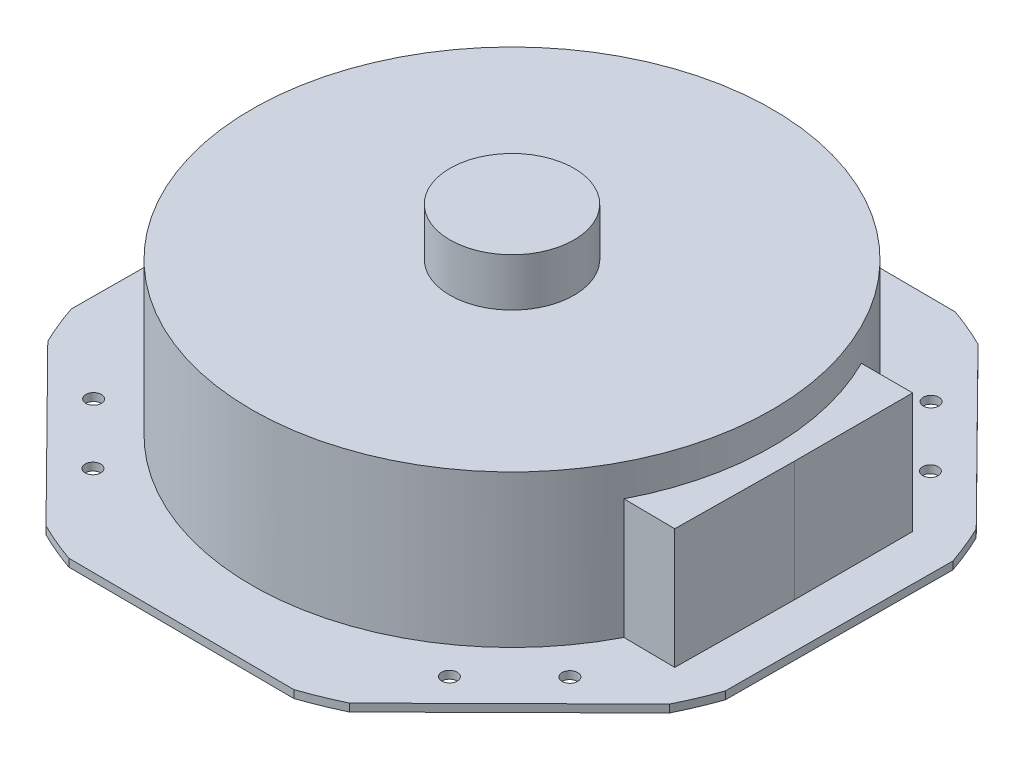
from build123d import *

# Parameters (mm, degrees)
EXTRUDE_1_DEPTH          = 10
SKETCH_3_R               = 335.5
EXTRUDE_4_DEPTH          = 196
EXTRUDE_5_DEPTH          = 154.8
SHELL_START              = 10
SHELL_3_OUTLINE_R        = 330.5
SHELL_3_DEPTH            = 191
SHELL_3_2_DEPTH          = 149.8
CUT_EXTRUDE_1_DEPTH      = 154.8
SKETCH_8_R               = 80
EXTRUDE_7_DEPTH          = 61.8
SKETCH_9_R               = 80
EXTRUDE_8_DEPTH          = 123.6
SKETCH_10_R              = 75
CUT_EXTRUDE_2_DEPTH      = 185.4
SKETCH_11_R              = 10
CUT_EXTRUDE_4_DEPTH      = 1000
PATTERN_CIRCULAR_1_COUNT = 4


# Read off the part's stored shape, not the designer's step: 抽壳3
with BuildPart() as part:
    # 草图2 → 凸台-拉伸1 (new body)
    with BuildSketch(Plane(origin=(0, 0, 0), x_dir=(1, 0, 0), z_dir=(0, 1, 0))):
        with BuildLine():
            ThreePointArc((198.880672379, 401.826082595), (173.884394221, 413.257716136), (148.234596604, 423.136180053))
            Line((148.234596604, 423.136180053), (-143.504075774, 424.763819947))
            ThreePointArc((-143.504075774, 424.763819947), (-169.262499161, 415.172167754), (-194.384773816, 404.020150746))
            Line((-194.384773816, 404.020150746), (-401.826082595, 198.880672379))
            ThreePointArc((-401.826082595, 198.880672379), (-413.257716136, 173.884394221), (-423.136180053, 148.234596604))
            Line((-423.136180053, 148.234596604), (-424.763819947, -143.504075774))
            ThreePointArc((-424.763819947, -143.504075774), (-415.172167754, -169.262499161), (-404.020150746, -194.384773816))
            Line((-404.020150746, -194.384773816), (-198.880672379, -401.826082595))
            ThreePointArc((-198.880672379, -401.826082595), (-173.884394221, -413.257716136), (-148.234596604, -423.136180053))
            Line((-148.234596604, -423.136180053), (143.504075774, -424.763819947))
            ThreePointArc((143.504075774, -424.763819947), (169.262499161, -415.172167754), (194.384773816, -404.020150746))
            Line((194.384773816, -404.020150746), (401.826082595, -198.880672379))
            ThreePointArc((401.826082595, -198.880672379), (413.257716136, -173.884394221), (423.136180053, -148.234596604))
            Line((423.136180053, -148.234596604), (424.763819947, 143.504075774))
            ThreePointArc((424.763819947, 143.504075774), (415.172167754, 169.262499161), (404.020150746, 194.384773816))
            Line((404.020150746, 194.384773816), (198.880672379, 401.826082595))
        make_face()
    extrude(amount=EXTRUDE_1_DEPTH)

    # 草图7 → 切除-拉伸1 (cut)
    with BuildSketch(Plane.XZ.offset(-10)):
        with BuildLine():
            Line((354.410601365, 144.423875342), (292.048813878, 143.7280081))
            ThreePointArc((292.048813878, 143.7280081), (-325.4949343, -1.815969532), (293.634330198, -140.460421931))
            Line((293.634330198, -140.460421931), (356, -140.460421931))
            Line((356, -140.460421931), (356, 1.986160414))
            Line((356, 1.986160414), (354.410601365, 144.423875342))
        make_face()
    extrude(amount=CUT_EXTRUDE_1_DEPTH, mode=Mode.SUBTRACT)


with BuildPart() as body_2:
    # 草图3 → 凸台-拉伸4 (new body)
    with BuildSketch(Plane(origin=(0, 10, 0), x_dir=(1, 0, 0), z_dir=(0, 1, 0))):
        with Locations(Location((0, 0, 0), (0, 0, 270))):
            Circle(SKETCH_3_R)
    extrude(amount=EXTRUDE_4_DEPTH)


with BuildPart() as body_3:
    # 草图6 → 凸台-拉伸5 (new body)
    with BuildSketch(Plane(origin=(0, 10, 0), x_dir=(1, 0, 0), z_dir=(0, 1, 0))):
        with BuildLine():
            Line((366, -2.041951437), (335.494778671, -1.871759687))
            ThreePointArc((335.494778671, -1.871759687), (325.812555489, -80.040169201), (298.172341087, -153.796960343))
            Line((298.172341087, -153.796960343), (364.298400285, -154.534831406))
            Line((364.298400285, -154.534831406), (366, -2.041951437))
        make_face()
        with BuildLine():
            ThreePointArc((335.5, 0), (335.498694665, -0.935883485), (335.494778671, -1.871759687))
            Line((335.494778671, -1.871759687), (366, -2.041951437))
            Line((366, -2.041951437), (366, 150.460421931))
            Line((366, 150.460421931), (299.869824144, 150.460421931))
            ThreePointArc((299.869824144, 150.460421931), (326.470960424, 77.310814249), (335.5, 0))
        make_face()
    extrude(amount=EXTRUDE_5_DEPTH)


with BuildPart() as body_2_1:
    add(body_2.part)

    # Combine 1: union body 3
    add(body_3.part)

    # 抽壳3 outline → 抽壳3 (cut)
    with BuildSketch(Plane(origin=(0, 0, 0), x_dir=(1, 0, 0), z_dir=(0, 1, 0)).offset(SHELL_START)):
        Circle(SHELL_3_OUTLINE_R)
    extrude(amount=SHELL_3_DEPTH, mode=Mode.SUBTRACT)

    # Shell 3 2 outline → Shell 3 2 (cut)
    with BuildSketch(Plane(origin=(0, 0, 0), x_dir=(1, 0, 0), z_dir=(0, 1, 0)).offset(SHELL_START)):
        with BuildLine():
            ThreePointArc((296.76845461, 145.460421931), (330.494856485, -1.84386461), (295.126953902, -148.762666958))
            Line((295.126953902, -148.762666958), (359.354500825, -149.479353374))
            Line((359.354500825, -149.479353374), (361, -2.014055926))
            Line((361, -2.014055926), (361, 145.460421931))
            Line((361, 145.460421931), (296.76845461, 145.460421931))
        make_face()
    extrude(amount=SHELL_3_2_DEPTH, mode=Mode.SUBTRACT)

    # Combine 2: union part
    add(part.part)

    # 草图8 → 凸台-拉伸7 (add)
    with BuildSketch(Plane(origin=(0, 206, 0), x_dir=(1, 0, 0), z_dir=(0, 1, 0))):
        with Locations(Location((0, 0, 0), (0, 0, 270))):
            Circle(SKETCH_8_R)
    extrude(amount=EXTRUDE_7_DEPTH)

    # 草图9 → 凸台-拉伸8 (add)
    with BuildSketch(Plane(origin=(0, 201, 0), x_dir=(-1, 0, 0), z_dir=(0, -1, 0))):
        with Locations(Location((0, 0, 0), (0, 0, 270))):
            Circle(SKETCH_9_R)
    extrude(amount=EXTRUDE_8_DEPTH)

    # 草图10 → 切除-拉伸2 (cut)
    with BuildSketch(Plane.XZ.offset(-77.4)):
        with Locations(Location((0, 0, 0), (0, 0, 270))):
            Circle(SKETCH_10_R)
    extrude(amount=-CUT_EXTRUDE_2_DEPTH, mode=Mode.SUBTRACT)

    # 草图11 → 切除-拉伸4 (cut)
    with BuildSketch(Plane(origin=(0, 206, 0), x_dir=(1, 0, 0), z_dir=(0, 1, 0))):
        with Locations(Location((-229.340075244, 309.990589083, 0), (0, 0, 270))):
            Circle(SKETCH_11_R)
        with Locations(Location((-307.412348087, 232.784629383, 0), (0, 0, 270))):
            Circle(SKETCH_11_R)
    cut_extrude_4 = extrude(amount=-CUT_EXTRUDE_4_DEPTH, mode=Mode.SUBTRACT)

    # 阵列(圆周)1: 切除-拉伸4 ×4 about axis
    pattern_circular_1_axis = Axis((0, 0, 0), (0, 1, 0))
    for i in range(1, PATTERN_CIRCULAR_1_COUNT):
        add(cut_extrude_4.rotate(pattern_circular_1_axis, i * 360 / PATTERN_CIRCULAR_1_COUNT), mode=Mode.SUBTRACT)


solid = body_2_1.part
